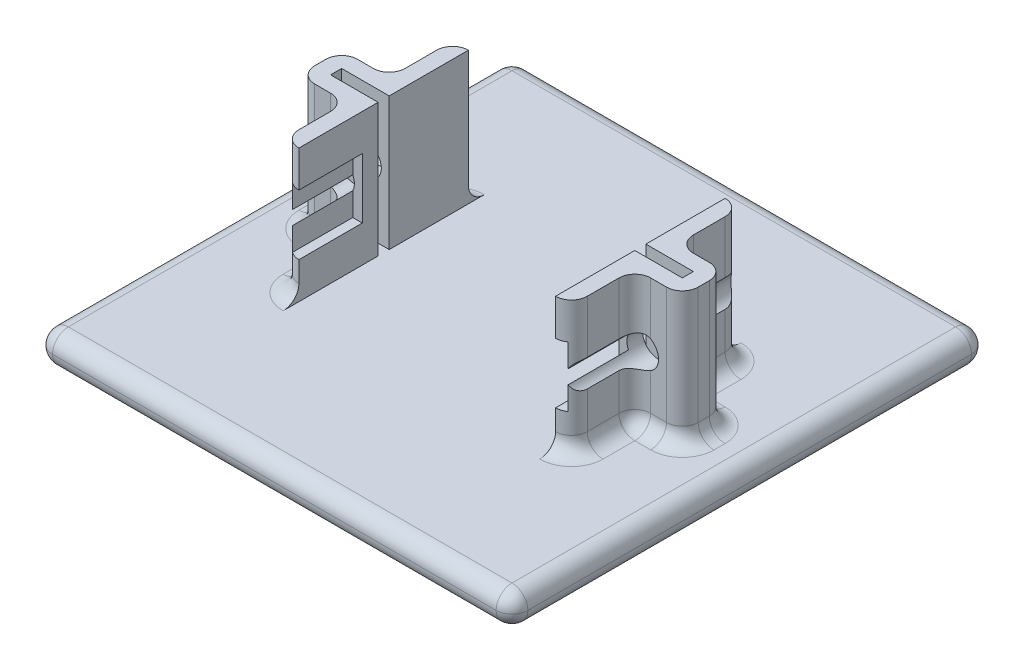
from build123d import *

# Parameters (mm, degrees)
SKETCH1_W              = 30
SKETCH1_H              = 30
BOSS_EXTRUDE1_DEPTH    = 2
BOSS_EXTRUDE2_DEPTH    = 8.4
FILLET1_R              = 1
CUT_EXTRUDE1_START     = -6.566028302
CUT_EXTRUDE1_OUTLINE_R = 1
CUT_EXTRUDE1_DEPTH     = 10.432056604
SKETCH6_W              = 4
SKETCH6_H              = 3.8
CUT_EXTRUDE2_DEPTH     = 0.6
CUT_EXTRUDE3_START     = 16.2
SKETCH6_2_W            = 4
SKETCH6_2_H            = 3.8
CUT_EXTRUDE3_DEPTH     = 0.6
FILLET2_R              = 1


# Read off the part's stored shape, not the designer's step: Cut-Extrude1, Mirror1
# Some blends are built 0.0001 mm under size
with BuildPart() as part:
    # Sketch1 → Boss-Extrude1 (new body)
    with BuildSketch(Plane(origin=(0, 0, 0), x_dir=(1, 0, 0), z_dir=(0, 1, 0))):
        Rectangle(SKETCH1_W, SKETCH1_H)
    extrude(amount=BOSS_EXTRUDE1_DEPTH)

    # Sketch2 → Boss-Extrude2 (add)
    with BuildSketch(Plane(origin=(0, 2, 0), x_dir=(1, 0, 0), z_dir=(0, 1, 0))):
        Polygon((-9.1, 5.35), (-8.1, 5.35), (-8.1, 0.35), (-11.1, 0.35), (-11.1, -0.35), (-8.1, -0.35), (-8.1, -5.35), (-9.1, -5.35), (-9.1, -1.35), (-12.1, -1.35), (-12.1, 1.35), (-9.1, 1.35), align=None)
    extrude(amount=BOSS_EXTRUDE2_DEPTH)

    # Fillet1
    # the kernel refuses this fillet: 1 mm, written as the material it adds along each edge
    with BuildSketch(Plane(origin=(-9.1, 2, -1.35), x_dir=(0, 0, -1), z_dir=(0, 1, 0)), Plane(origin=(-9.1, 2, 1.35), x_dir=(-1, 0, 0), z_dir=(0, 1, 0))) as fillet1_piece_1:
        with BuildLine():
            CenterArc((FILLET1_R, FILLET1_R), FILLET1_R, 180, 90)
            Line((0, FILLET1_R), (0, 0))
            Line((0, 0), (FILLET1_R, 0))
        make_face()
    extrude(amount=8.4)
    # the kernel refuses this fillet: 1 mm, written as the material it takes off along each edge
    with BuildSketch(Plane(origin=(-9.1, 2, -5.35), x_dir=(1, 0, 0), z_dir=(0, 1, 0)), Plane(origin=(-12.1, 2, -1.35), x_dir=(1, 0, 0), z_dir=(0, 1, 0)), Plane(origin=(-12.1, 2, 1.35), x_dir=(0, 0, -1), z_dir=(0, 1, 0)), Plane(origin=(-9.1, 2, 5.35), x_dir=(0, 0, -1), z_dir=(0, 1, 0))) as fillet1_2_piece_1:
        with BuildLine():
            CenterArc((FILLET1_R, -FILLET1_R), FILLET1_R, 90, 90)
            Line((0, -FILLET1_R), (0, 0))
            Line((0, 0), (FILLET1_R, 0))
        make_face()
    extrude(amount=10.9, mode=Mode.SUBTRACT)
    # the kernel refuses this fillet: 1 mm, written as the material it adds along each edge
    with BuildSketch(Plane(origin=(-9.1, 2, -2.35), x_dir=(-1, 0, 0), z_dir=(0, 0, -1)), Plane(origin=(-9.1, 2, 4.35), x_dir=(-1, 0, 0), z_dir=(0, 0, -1))) as fillet1_3_piece_1:
        with BuildLine():
            CenterArc((FILLET1_R, FILLET1_R), FILLET1_R, 180, 90)
            Line((0, FILLET1_R), (0, 0))
            Line((0, 0), (FILLET1_R, 0))
        make_face()
    extrude(amount=2)
    with BuildSketch(Plane(origin=(-11.1, 2, -1.35), x_dir=(0, 0, -1), z_dir=(1, 0, 0)), Plane(origin=(-10.1, 2, 1.35), x_dir=(0, 0, 1), z_dir=(-1, 0, 0))) as fillet1_3_piece_2:
        with BuildLine():
            CenterArc((FILLET1_R, FILLET1_R), FILLET1_R, 180, 90)
            Line((0, FILLET1_R), (0, 0))
            Line((0, 0), (FILLET1_R, 0))
        make_face()
    extrude(amount=1)
    with BuildSketch(Plane(origin=(-12.1, 2, 0.35), x_dir=(-1, 0, 0), z_dir=(0, 0, -1))) as fillet1_3_piece_3:
        with BuildLine():
            CenterArc((FILLET1_R, FILLET1_R), FILLET1_R, 180, 90)
            Line((0, FILLET1_R), (0, 0))
            Line((0, 0), (FILLET1_R, 0))
        make_face()
    extrude(amount=0.7)
    with BuildSketch(Plane(origin=(-8.1, 2, 4.35), x_dir=(-1, 0, 0), z_dir=(0, 0, -1))) as fillet1_3_piece_4:
        with BuildLine():
            CenterArc((1 + FILLET1_R, FILLET1_R), FILLET1_R, 180, 90)
            Line((1, FILLET1_R), (1, 0))
            Line((1, 0), (1 + FILLET1_R, 0))
        make_face()
    revolve(axis=Axis((-8.1, 2, 4.35), (0, 1, 0)), revolution_arc=90)
    with BuildSketch(Plane(origin=(-10.1, 2, 2.35), x_dir=(0, 0, -1), z_dir=(-1, 0, 0))) as fillet1_3_piece_5:
        with BuildLine():
            CenterArc((1 - FILLET1_R, -FILLET1_R), FILLET1_R, 0, 90)
            Line((1, -FILLET1_R), (1, 0))
            Line((1, 0), (1 - FILLET1_R, 0))
        make_face()
    revolve(axis=Axis((-10.1, 2, 2.35), (0, -1, 0)), revolution_arc=90)
    with BuildSketch(Plane(origin=(-11.1, 2, 0.35), x_dir=(-1, 0, 0), z_dir=(0, 0, -1))) as fillet1_3_piece_6:
        with BuildLine():
            CenterArc((1 + FILLET1_R, FILLET1_R), FILLET1_R, 180, 90)
            Line((1, FILLET1_R), (1, 0))
            Line((1, 0), (1 + FILLET1_R, 0))
        make_face()
    revolve(axis=Axis((-11.1, 2, 0.35), (0, 1, 0)), revolution_arc=90)
    with BuildSketch(Plane(origin=(-11.1, 2, -0.35), x_dir=(0, 0, -1), z_dir=(1, 0, 0))) as fillet1_3_piece_7:
        with BuildLine():
            CenterArc((1 + FILLET1_R, FILLET1_R), FILLET1_R, 180, 90)
            Line((1, FILLET1_R), (1, 0))
            Line((1, 0), (1 + FILLET1_R, 0))
        make_face()
    revolve(axis=Axis((-11.1, 2, -0.35), (0, 1, 0)), revolution_arc=90)
    with BuildSketch(Plane(origin=(-10.1, 2, -2.35), x_dir=(1, 0, 0), z_dir=(0, 0, -1))) as fillet1_3_piece_8:
        with BuildLine():
            CenterArc((1 - FILLET1_R, -FILLET1_R), FILLET1_R, 0, 90)
            Line((1, -FILLET1_R), (1, 0))
            Line((1, 0), (1 - FILLET1_R, 0))
        make_face()
    revolve(axis=Axis((-10.1, 2, -2.35), (0, -1, 0)), revolution_arc=90)
    with BuildSketch(Plane(origin=(-8.1, 2, -4.35), x_dir=(0, 0, -1), z_dir=(1, 0, 0))) as fillet1_3_piece_9:
        with BuildLine():
            CenterArc((1 + FILLET1_R, FILLET1_R), FILLET1_R, 180, 90)
            Line((1, FILLET1_R), (1, 0))
            Line((1, 0), (1 + FILLET1_R, 0))
        make_face()
    revolve(axis=Axis((-8.1, 2, -4.35), (0, 1, 0)), revolution_arc=90)

    # Cut-Extrude1 outline → Cut-Extrude1 (cut)
    with BuildSketch(Plane.XY.offset(1.35).offset(CUT_EXTRUDE1_START)):
        with Locations((-9.6, 6.2)):
            Circle(CUT_EXTRUDE1_OUTLINE_R)
    extrude(amount=CUT_EXTRUDE1_DEPTH, mode=Mode.SUBTRACT)

    # Mirror1: part across plane


with BuildPart() as part_1:
    add(part.part)
    add(part.part.mirror(Plane(origin=(0, 0, 0), x_dir=(0, 0, 1), z_dir=(1, 0, 0))))

    # Sketch6 → Cut-Extrude2 (cut)
    with BuildSketch(Plane.ZY.offset(-8.1)):
        with Locations((3.35, 6.2)):
            Rectangle(SKETCH6_W, SKETCH6_H)
    extrude(amount=-CUT_EXTRUDE2_DEPTH, mode=Mode.SUBTRACT)

    # Sketch6<2> → Cut-Extrude3 (cut)
    with BuildSketch(Plane.ZY.offset(-8.1).offset(CUT_EXTRUDE3_START)):
        with Locations((3.35, 6.2)):
            Rectangle(SKETCH6_2_W, SKETCH6_2_H)
    extrude(amount=CUT_EXTRUDE3_DEPTH, mode=Mode.SUBTRACT)

    # Fillet2
    fillet2_edges = [part_1.edges().sort_by_distance(p)[0] for p in [
        (-15, 2, 0),
        (0, 2, 15),
        (15, 2, 0),
        (0, 0, 15),
        (-15, 0, 0),
        (0, 0, -15),
        (15, 0, 0),
        (15, 1, 15),
        (-15, 1, 15),
        (-15, 1, -15),
        (15, 1, -15),
        (0, 2, -15),
    ]]
    fillet(fillet2_edges, radius=FILLET2_R - 0.0001)  # a hair under: the kernel refuses the full size


solid = part_1.part
